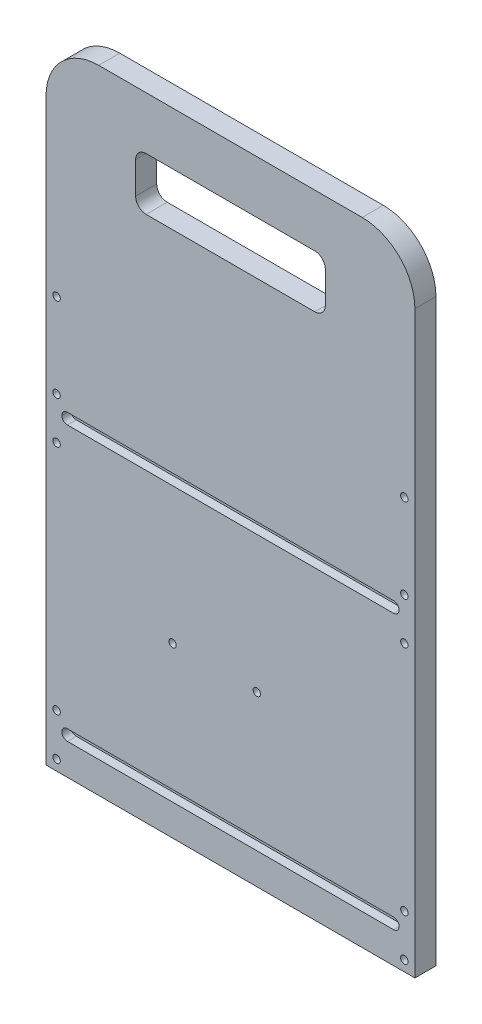
from build123d import *

# Parameters (mm, degrees)
SKETCH1_W                                         = 222.25
SKETCH1_H                                         = 381
BOSS_EXTRUDE1_DEPTH                               = 12.7
FILLET1_R                                         = 31.75
SKETCH2_W                                         = 114.3
SKETCH2_H                                         = 31.75
CUT_EXTRUDE1_DEPTH                                = 12.7
FILLET2_R                                         = 6.35
SKETCH3_W                                         = 203.2
SKETCH3_H                                         = 6.604
CUT_EXTRUDE2_DEPTH                                = 5.334
FILLET3_R                                         = 3.302
CSK_FOR_8_FLAT_HEAD_MACHINE_SCREW_100_D           = 4.4958
CSK_FOR_8_FLAT_HEAD_MACHINE_SCREW_100_CSINK_D     = 8.4328
CSK_FOR_8_FLAT_HEAD_MACHINE_SCREW_100_CSINK_ANGLE = 100


with BuildPart() as part:
    # Sketch1 → Boss-Extrude1 (new body)
    with BuildSketch(Plane.XY):
        Rectangle(SKETCH1_W, SKETCH1_H)
    extrude(amount=BOSS_EXTRUDE1_DEPTH)

    # Fillet1
    fillet1_edges = [part.edges().sort_by_distance(p)[0] for p in [
        (111.125, 190.5, 6.35),
        (-111.125, 190.5, 6.35),
    ]]
    fillet(fillet1_edges, radius=FILLET1_R)

    # Sketch2 → Cut-Extrude1 (cut)
    with BuildSketch(Plane.XY.offset(12.7)):
        with Locations((0, 142.875)):
            Rectangle(SKETCH2_W, SKETCH2_H)
    extrude(amount=-CUT_EXTRUDE1_DEPTH, mode=Mode.SUBTRACT)

    # Fillet2
    fillet2_edges = [part.edges().sort_by_distance(p)[0] for p in [
        (57.15, 127, 6.35),
        (57.15, 158.75, 6.35),
        (-57.15, 158.75, 6.35),
        (-57.15, 127, 6.35),
    ]]
    fillet(fillet2_edges, radius=FILLET2_R)

    # Sketch3 → Cut-Extrude2 (cut)
    with BuildSketch(Plane.XY.offset(12.7)):
        with Locations((0, -168.402)):
            Rectangle(SKETCH3_W, SKETCH3_H)
        with Locations((0, -3.302)):
            Rectangle(SKETCH3_W, SKETCH3_H)
    extrude(amount=-CUT_EXTRUDE2_DEPTH, mode=Mode.SUBTRACT)

    # Fillet3
    fillet3_edges = [part.edges().sort_by_distance(p)[0] for p in [
        (101.6, -165.1, 10.033),
        (101.6, -171.704, 10.033),
        (-101.6, -171.704, 10.033),
        (-101.6, -165.1, 10.033),
        (101.6, -6.604, 10.033),
        (101.6, 0, 10.033),
        (-101.6, 0, 10.033),
        (-101.6, -6.604, 10.033),
    ]]
    fillet(fillet3_edges, radius=FILLET3_R - 0.0001)  # a hair under: the kernel refuses the full size

    # CSK for #8 Flat Head Machine Screw (100)1 (through all)
    with Locations(Plane(origin=(0, 0, 0), x_dir=(-1, 0, 0), z_dir=(0, 0, -1))):
        with Locations((-104.775, -184.15), (-104.775, -158.75), (104.775, -158.75), (104.775, -184.15), (-104.775, -19.05), (-104.775, 6.35), (104.775, 6.35), (104.775, -19.05), (-104.775, 57.15), (104.775, 57.15), (-15.875, -88.9), (34.925, -88.9)):
            CounterSinkHole(CSK_FOR_8_FLAT_HEAD_MACHINE_SCREW_100_D / 2, CSK_FOR_8_FLAT_HEAD_MACHINE_SCREW_100_CSINK_D / 2, counter_sink_angle=CSK_FOR_8_FLAT_HEAD_MACHINE_SCREW_100_CSINK_ANGLE)


solid = part.part
